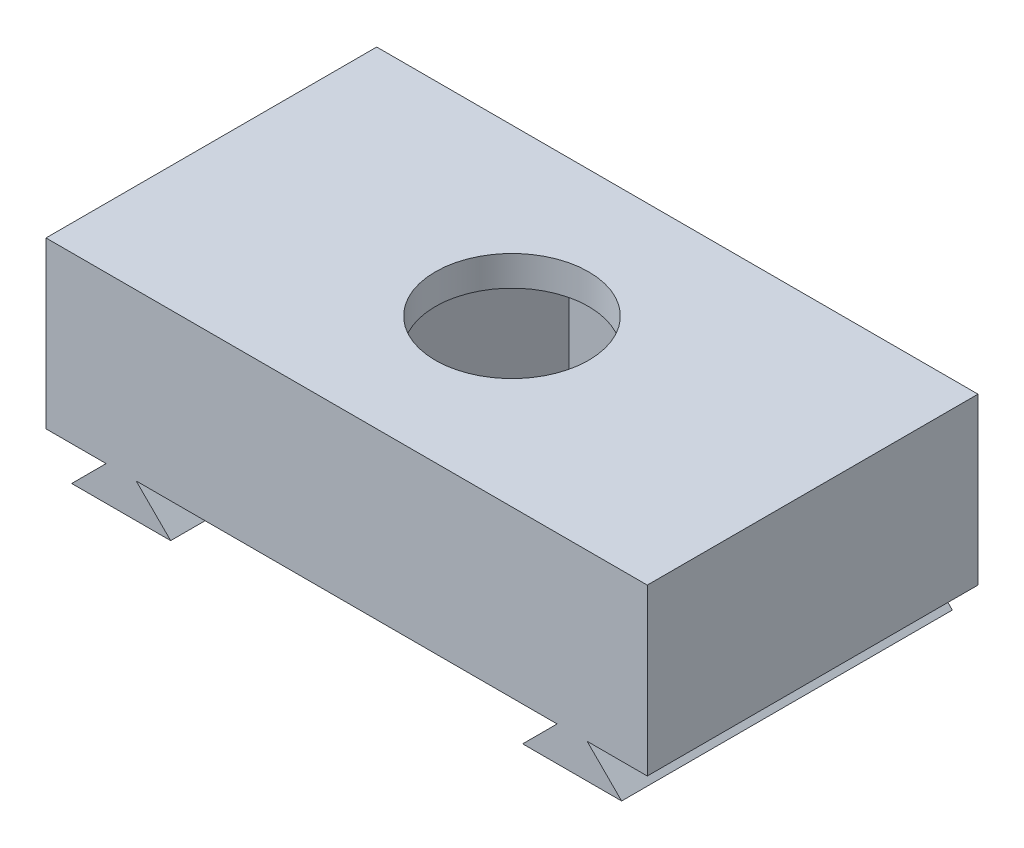
from build123d import *

# Parameters (mm, degrees)
BOSS_EXTRUDE1_DEPTH = 22
CUT_EXTRUDE1_DEPTH  = 9
SKETCH3_R           = 5.1
CUT_EXTRUDE2_DEPTH  = 48.201694885
SHELL2_START        = 2
SHELL2_DEPTH        = 7
SHELL2_2_DEPTH      = 18
CUT_EXTRUDE4_DEPTH  = 47.957427527


# Read off the part's stored shape, not the designer's step: Shell2
with BuildPart() as part:
    # Sketch1 → Boss-Extrude1 (new body)
    with BuildSketch(Plane.XY):
        Polygon((0, 0), (3, 0), (0, -3), (10, -3), (7, 0), (33, 0), (30, -3), (40, -3), (37, 0), (40, 0), (40, 11), (0, 11), align=None)
    extrude(amount=BOSS_EXTRUDE1_DEPTH)

    # Sketch2 → Cut-Extrude1 (cut)
    with BuildSketch(Plane(origin=(0, 0, 0), x_dir=(-1, 0, 0), z_dir=(0, -1, 0))):
        Polygon((-14.803847577, -20), (-25.196152423, -20), (-30.392304845, -11), (-25.196152423, -2), (-14.803847577, -2), (-9.607695155, -11), align=None)
    extrude(amount=-CUT_EXTRUDE1_DEPTH, mode=Mode.SUBTRACT)

    # Sketch3 → Cut-Extrude2 (cut, through all)
    with BuildSketch(Plane(origin=(0, 9, 0), x_dir=(-1, 0, 0), z_dir=(0, -1, 0))):
        with Locations(Location((-20, -11, 0), (0, 0, 180))):
            Circle(SKETCH3_R)
    extrude(amount=-CUT_EXTRUDE2_DEPTH, mode=Mode.SUBTRACT)

    # Shell2 outline → Shell2 (cut)
    with BuildSketch(Plane(origin=(0, 0, 0), x_dir=(1, 0, 0), z_dir=(0, 1, 0)).offset(SHELL2_START)):
        Polygon((2, -2), (2, -20), (12.494446501, -20), (7.298294078, -11), (12.494446501, -2), align=None)
        Polygon((32.701705922, -11), (27.505553499, -20), (38, -20), (38, -2), (27.505553499, -2), align=None)
    extrude(amount=SHELL2_DEPTH, mode=Mode.SUBTRACT)

    # Shell2 2 outline → Shell2 2 (cut)
    with BuildSketch(Plane.XY.offset(SHELL2_START)):
        Polygon((5.171572875, -1), (5, -0.828427125), (4.828427125, -1), align=None)
        Polygon((34.828427125, -1), (35.171572875, -1), (35, -0.828427125), align=None)
    extrude(amount=SHELL2_2_DEPTH, mode=Mode.SUBTRACT)

    # Sketch6 → Cut-Extrude4 (cut, through all)
    with BuildSketch(Plane.XY.offset(22)):
        Polygon((31.707106781, -2.292893219), (34, 0), (33, 0), (30, -3), (40, -3), (37, 0), (36, 0), (38.292893219, -2.292893219), align=None)
        Polygon((1.707106781, -2.292893219), (4, 0), (3, 0), (0, -3), (10, -3), (7, 0), (6, 0), (8.292893219, -2.292893219), align=None)
    extrude(amount=-CUT_EXTRUDE4_DEPTH, mode=Mode.SUBTRACT)


solid = part.part
